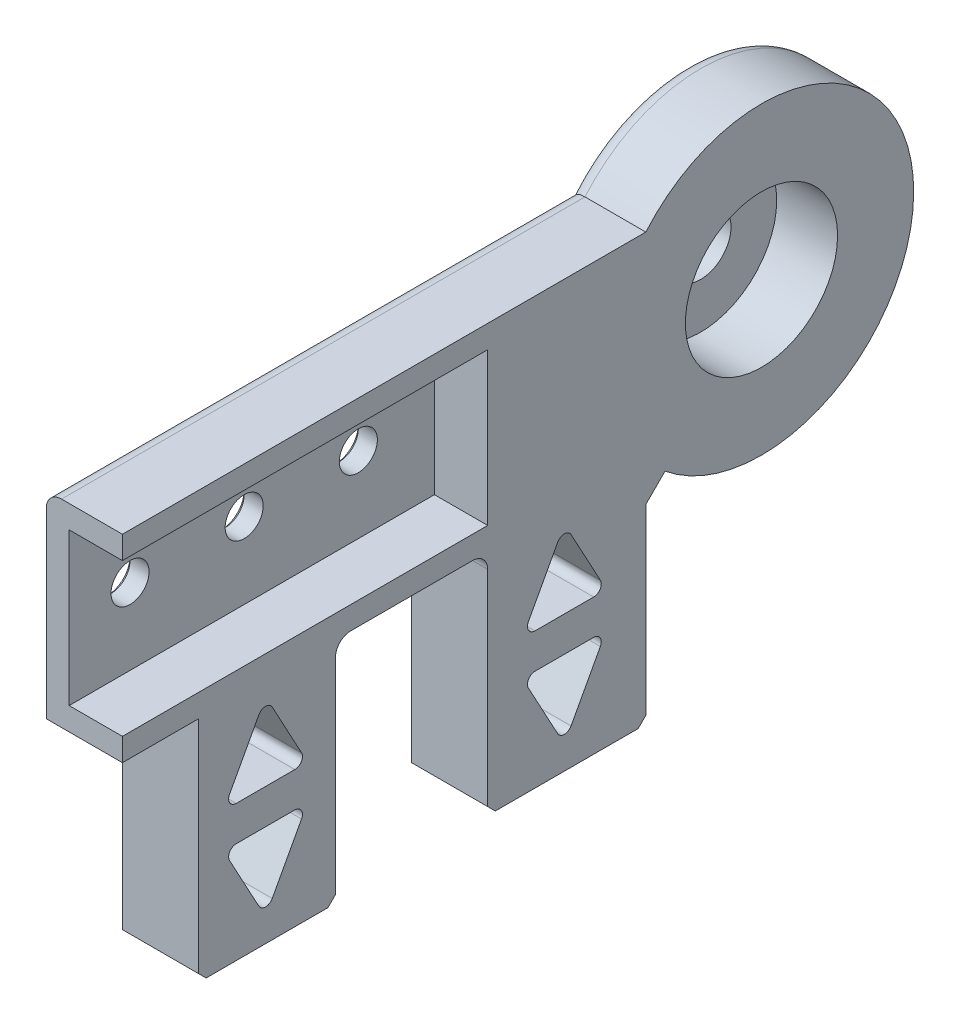
from build123d import *

# Parameters (mm, degrees)
SKETCH_1_R          = 20
SKETCH_1_W          = 63.973509934
SKETCH_1_H          = 26
EXTRUDE_1_DEPTH     = 10
SKETCH_2_W          = 45
SKETCH_2_H          = 20
CUT_EXTRUDE_1_DEPTH = 7
SKETCH_3_R          = 10
CUT_EXTRUDE_2_DEPTH = 8
SKETCH_4_R          = 4
CUT_EXTRUDE_3_DEPTH = 7
SKETCH_6_W          = 10
SKETCH_6_H          = 8
EXTRUDE_2_DEPTH     = 15
CHAMFER_2_SIZE      = 5
EXTRUDE_3_DEPTH     = 20
SKETCH_8_W          = 10
SKETCH_8_H          = 12.77482578
EXTRUDE_4_DEPTH     = 15
SKETCH_9_W          = 7
SKETCH_9_H          = 20
EXTRUDE_5_DEPTH     = 10
SKETCH_10_W         = 7
SKETCH_10_H         = 20
EXTRUDE_6_DEPTH     = 7
SKETCH_11_W         = 10
SKETCH_11_H         = 15
CUT_EXTRUDE_5_DEPTH = 60.88841868
SKETCH_12_W         = 10
SKETCH_12_H         = 18
SKETCH_12_H_2       = 20.77482578
EXTRUDE_7_DEPTH     = 15
CUT_EXTRUDE_6_DEPTH = 15
FILLET_1_R          = 1
CHAMFER_3_SIZE      = 1
FILLET_2_R          = 2
SKETCH_14_R         = 7.5
SKETCH_14_R_2       = 4
EXTRUDE_8_DEPTH     = 2
FILLET_3_R          = 2
SKETCH_16_R         = 2.5
CUT_EXTRUDE_7_DEPTH = 3
CHAMFER_4_SIZE      = 0.5
FILLET_4_R          = 2


# Some blends are built 0.0001 mm under size
with BuildPart() as part:
    # 草图1 → 凸台-拉伸1 (new body)
    with BuildSketch(Plane(origin=(0, 0, 0), x_dir=(0, 0, -1), z_dir=(1, 0, 0))):
        with Locations((31.986754967, 0)):
            Circle(SKETCH_1_R)
        Rectangle(SKETCH_1_W, SKETCH_1_H)
    extrude(amount=EXTRUDE_1_DEPTH)

    # 草图2 → 切除-拉伸1 (cut)
    with BuildSketch(Plane(origin=(10, 0, 0), x_dir=(0, 0, -1), z_dir=(1, 0, 0))):
        with Locations((-9.486754967, 0)):
            Rectangle(SKETCH_2_W, SKETCH_2_H)
    extrude(amount=-CUT_EXTRUDE_1_DEPTH, mode=Mode.SUBTRACT)

    # 草图3 → 切除-拉伸2 (cut)
    with BuildSketch(Plane(origin=(10, 0, 0), x_dir=(0, 0, -1), z_dir=(1, 0, 0))):
        with Locations((31.986754967, 0)):
            Circle(SKETCH_3_R)
    extrude(amount=-CUT_EXTRUDE_2_DEPTH, mode=Mode.SUBTRACT)

    # 草图4 → 切除-拉伸3 (cut)
    with BuildSketch(Plane(origin=(2, 0, 0), x_dir=(0, 0, -1), z_dir=(1, 0, 0))):
        with Locations((31.986754967, 0)):
            Circle(SKETCH_4_R)
    extrude(amount=-CUT_EXTRUDE_3_DEPTH, mode=Mode.SUBTRACT)

    # 草图6 → 凸台-拉伸2 (add)
    with BuildSketch(Plane.XZ.offset(13)):
        with Locations((5, -12.788070813)):
            Rectangle(SKETCH_6_W, SKETCH_6_H)
        with Locations((5, 27.986754967)):
            Rectangle(SKETCH_6_W, SKETCH_6_H)
    extrude(amount=EXTRUDE_2_DEPTH)

    # 倒角2
    # the kernel refuses this chamfer: 5, 3.546264764 mm, written as the material it adds along each edge
    with BuildSketch(Plane(origin=(10, -13, -16.788070813), x_dir=(0, -0.6995038411281902, -0.7146288381019251), z_dir=(-1, 0, 0))) as chamfer_2_piece_1:
        with BuildLine():
            Line((3.535736125, 0), (CHAMFER_2_SIZE * 0.699503841128, CHAMFER_2_SIZE * 0.714628838102))
            Line((CHAMFER_2_SIZE * 0.699503841128, CHAMFER_2_SIZE * 0.714628838102), (0, 0))
            ThreePointArc((0, 0), (1.768947181, 0.07828713), (3.535736125, 0))
        make_face()
    extrude(amount=10)

    # 草图7 → 凸台-拉伸3 (add)
    with BuildSketch(Plane.XY.offset(31.986754967)):
        Polygon((3, -10), (3, 10), (10, 10), (10, 13), (0, 13), (0, -28), (10, -28), (10, -10), align=None)
    extrude(amount=EXTRUDE_3_DEPTH)

    # 草图8 → 凸台-拉伸4 (add)
    with BuildSketch(Plane.XZ.offset(13)):
        with Locations((5, -2.400657923)):
            Rectangle(SKETCH_8_W, SKETCH_8_H)
    extrude(amount=EXTRUDE_4_DEPTH)

    # 草图9 → 凸台-拉伸5 (add)
    with BuildSketch(Plane.XY.offset(-13.013245033)):
        with Locations((6.5, 0)):
            Rectangle(SKETCH_9_W, SKETCH_9_H)
    extrude(amount=EXTRUDE_5_DEPTH)

    # 草图10 → 凸台-拉伸6 (add)
    with BuildSketch(Plane.XY.offset(-3.013245033)):
        with Locations((6.5, 0)):
            Rectangle(SKETCH_10_W, SKETCH_10_H)
    extrude(amount=EXTRUDE_6_DEPTH)

    # 草图11 → 切除-拉伸5 (cut, through all)
    with BuildSketch(Plane(origin=(10, 0, 0), x_dir=(0, 0, -1), z_dir=(1, 0, 0))):
        with Locations((-46.986754967, -20.5)):
            Rectangle(SKETCH_11_W, SKETCH_11_H)
    extrude(amount=-CUT_EXTRUDE_5_DEPTH, mode=Mode.SUBTRACT)

    # 草图12 → 凸台-拉伸7 (add)
    with BuildSketch(Plane.XZ.offset(28)):
        with Locations((5, 32.986754967)):
            Rectangle(SKETCH_12_W, SKETCH_12_H)
        with Locations((5, -6.400657923)):
            Rectangle(SKETCH_12_W, SKETCH_12_H_2)
    extrude(amount=EXTRUDE_7_DEPTH)

    # 草图13 → 切除-拉伸6 (cut)
    with BuildSketch(Plane.ZY):
        Polygon((-11.611311333, -29.697810406), (-0.558833166, -29.697810406), (-6.085072249, -39.916139278), align=None)
        Polygon((-6.085072249, -14.886974177), (-11.611311333, -25.105303048), (-0.558833166, -25.105303048), align=None)
        Polygon((38.707104745, -25.105303048), (27.654626578, -25.105303048), (33.180865662, -14.886974177), align=None)
        Polygon((33.180865662, -39.916139278), (38.707104745, -29.697810406), (27.654626578, -29.697810406), align=None)
    extrude(amount=-CUT_EXTRUDE_6_DEPTH, mode=Mode.SUBTRACT)

    # 圆角1
    fillet_1_edges = [part.edges().sort_by_distance(p)[0] for p in [
        (5, -39.916139278, 33.180865662),
        (5, -29.697810406, 27.654626578),
        (5, -29.697810406, 38.707104745),
        (5, -14.886974177, 33.180865662),
        (5, -25.105303048, 38.707104745),
        (5, -25.105303048, 27.654626578),
        (5, -14.886974177, -6.085072249),
        (5, -25.105303048, -0.558833166),
        (5, -25.105303048, -11.611311333),
        (5, -39.916139278, -6.085072249),
        (5, -29.697810406, -11.611311333),
        (5, -29.697810406, -0.558833166),
    ]]
    fillet(fillet_1_edges, radius=FILLET_1_R)

    # 倒角3
    chamfer_3_edges = [part.edges().sort_by_distance(p)[0] for p in [
        (5, -43, 41.986754967),
        (5, -43, 23.986754967),
        (5, -43, 3.986754967),
        (5, -43, -16.788070813),
    ]]
    chamfer(chamfer_3_edges, length=CHAMFER_3_SIZE)

    # 圆角2
    fillet_2_edges = [part.edges().sort_by_distance(p)[0] for p in [
        (5, -13, 3.986754967),
        (5, -13, 23.986754967),
    ]]
    fillet(fillet_2_edges, radius=FILLET_2_R)

    # 草图14 → 凸台-拉伸8 (add)
    with BuildSketch(Plane.ZY):
        with Locations(Location((-31.986754967, 0, 0), (0, 0, 180))):
            Circle(SKETCH_14_R)
        with Locations(Location((-31.986754967, 0, 0), (0, 0, 180))):
            Circle(SKETCH_14_R_2, mode=Mode.SUBTRACT)
    extrude(amount=EXTRUDE_8_DEPTH)

    # 圆角3
    fillet_3_edges = [part.edges().sort_by_distance(p)[0] for p in [
        (-2, 0, -24.486754967),
    ]]
    fillet(fillet_3_edges, radius=FILLET_3_R - 0.0001)  # a hair under: the kernel refuses the full size

    # 草图16 → 切除-拉伸7 (cut)
    with BuildSketch(Plane(origin=(3, 0, 0), x_dir=(0, 0, -1), z_dir=(1, 0, 0))):
        with Locations((-43.986754967, 0)):
            Circle(SKETCH_16_R)
        with Locations((-28.986754967, 0)):
            Circle(SKETCH_16_R)
        with Locations((-13.986754967, 0)):
            Circle(SKETCH_16_R)
    extrude(amount=-CUT_EXTRUDE_7_DEPTH, mode=Mode.SUBTRACT)

    # 倒角4
    chamfer_4_edges = [part.edges().sort_by_distance(p)[0] for p in [
        (0, 0, 46.486754967),
        (0, 0, 31.486754967),
        (0, 0, 16.486754967),
    ]]
    chamfer(chamfer_4_edges, length=CHAMFER_4_SIZE)

    # 圆角4
    fillet_4_edges = [part.edges().sort_by_distance(p)[0] for p in [
        (0, 13, 17.599342077),
        (0, 1.767868063, -51.908467808),
    ]]
    fillet(fillet_4_edges, radius=FILLET_4_R)


solid = part.part
